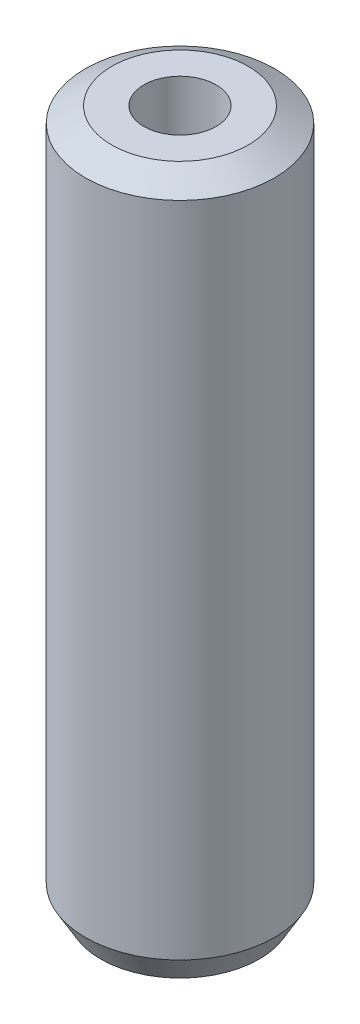
from build123d import *
from OCP.BRepFilletAPI import BRepFilletAPI_MakeChamfer

# Parameters (mm, degrees)
SKETCH1_R           = 30
BOSS_EXTRUDE1_DEPTH = 221.817528086
SKETCH2_R           = 11.4549096
CUT_EXTRUDE1_DEPTH  = 226.838472733
CHAMFER1_SIZE       = 4.82742767
CHAMFER1_SIZE2      = 8.361349994


with BuildPart() as part:
    # Sketch1 → Boss-Extrude1 (new body)
    with BuildSketch(Plane(origin=(0, 0, 0), x_dir=(1, 0, 0), z_dir=(0, 1, 0))):
        Circle(SKETCH1_R)
    extrude(amount=BOSS_EXTRUDE1_DEPTH)

    # Sketch2 → Cut-Extrude1 (cut, through all)
    with BuildSketch(Plane(origin=(0, 0, 0), x_dir=(1, 0, 0), z_dir=(0, 1, 0))):
        Circle(SKETCH2_R)
    extrude(amount=CUT_EXTRUDE1_DEPTH, mode=Mode.SUBTRACT)

    # Chamfer1: one chamfer whose edges measure the first distance from different faces: ONE call of the kernel's chamfer builder (chamfer() names one face for all edges)
    chamfer1_edges_1 = [part.edges().sort_by_distance(p)[0] for p in [
        (-30, 221.817528086, 0),
    ]]
    chamfer1_side_1 = [part.faces().sort_by_distance(p)[0] for p in [
        (-30, 110.908764043, 0),
    ]]
    chamfer1_edges_2 = [part.edges().sort_by_distance(p)[0] for p in [
        (-30, 0, 0),
    ]]
    chamfer1_side_2 = [part.faces().sort_by_distance(p)[0] for p in [
        (-29.151471863, 0, 0),
    ]]
    chamfer1 = BRepFilletAPI_MakeChamfer(part.part.solid().wrapped)
    for e in chamfer1_edges_1:
        chamfer1.Add(CHAMFER1_SIZE, CHAMFER1_SIZE2, e.wrapped, chamfer1_side_1[0].wrapped)  # the first distance lies on this face
    for e in chamfer1_edges_2:
        chamfer1.Add(CHAMFER1_SIZE, CHAMFER1_SIZE2, e.wrapped, chamfer1_side_2[0].wrapped)  # the first distance lies on this face
    add(Compound.cast(chamfer1.Shape()), mode=Mode.REPLACE)


solid = part.part
